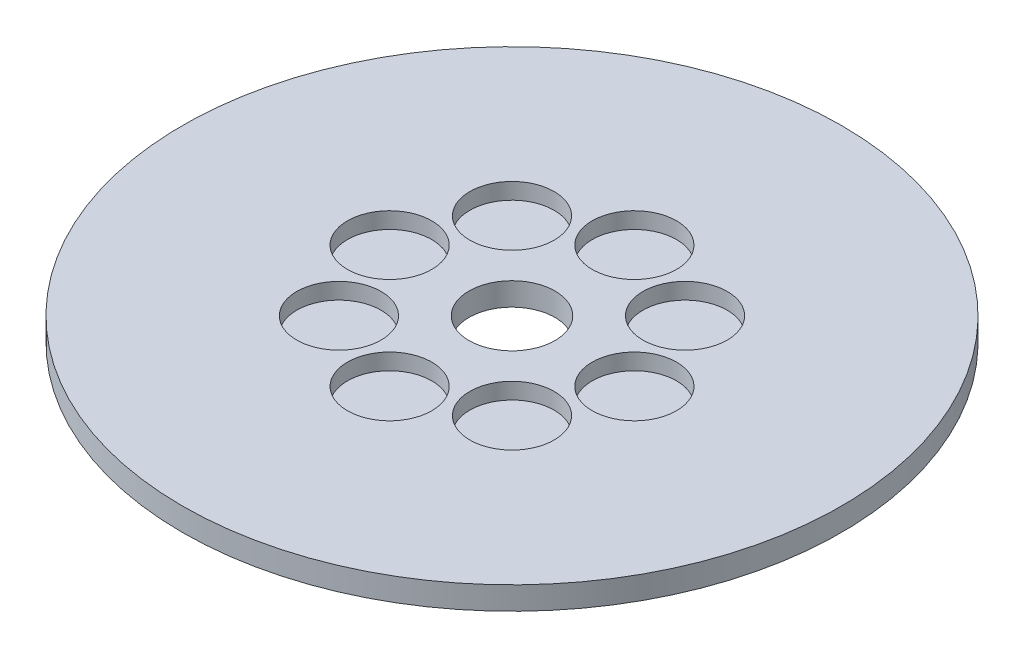
from build123d import *

# Parameters (mm, degrees)
SKETCH1_R           = 57.5
BOSS_EXTRUDE1_DEPTH = 4
SKETCH2_R           = 7.5
CUT_EXTRUDE1_DEPTH  = 82.415600471
SKETCH3_R           = 7.356533407
CUT_EXTRUDE2_DEPTH  = 2.837028008
CIRPATTERN1_COUNT   = 8


with BuildPart() as part:
    # Sketch1 → Boss-Extrude1 (new body)
    with BuildSketch(Plane(origin=(0, 0, 0), x_dir=(1, 0, 0), z_dir=(0, 1, 0))):
        Circle(SKETCH1_R)
    extrude(amount=BOSS_EXTRUDE1_DEPTH)

    # Sketch2 → Cut-Extrude1 (cut, through all)
    with BuildSketch(Plane(origin=(0, 0, 0), x_dir=(1, 0, 0), z_dir=(0, 1, 0))):
        Circle(SKETCH2_R)
    extrude(amount=CUT_EXTRUDE1_DEPTH, mode=Mode.SUBTRACT)

    # Sketch3 → Cut-Extrude2 (cut)
    with BuildSketch(Plane(origin=(0, 4, 0), x_dir=(1, 0, 0), z_dir=(0, 1, 0))):
        with Locations((-21.351262807, 0)):
            Circle(SKETCH3_R)
    cut_extrude2 = extrude(amount=-CUT_EXTRUDE2_DEPTH, mode=Mode.SUBTRACT)

    # CirPattern1: Cut-Extrude2 ×8 about axis
    cirpattern1_axis = Axis((0, 0, 0), (0, 1, 0))
    for i in range(1, CIRPATTERN1_COUNT):
        add(cut_extrude2.rotate(cirpattern1_axis, i * 360 / CIRPATTERN1_COUNT), mode=Mode.SUBTRACT)


solid = part.part
